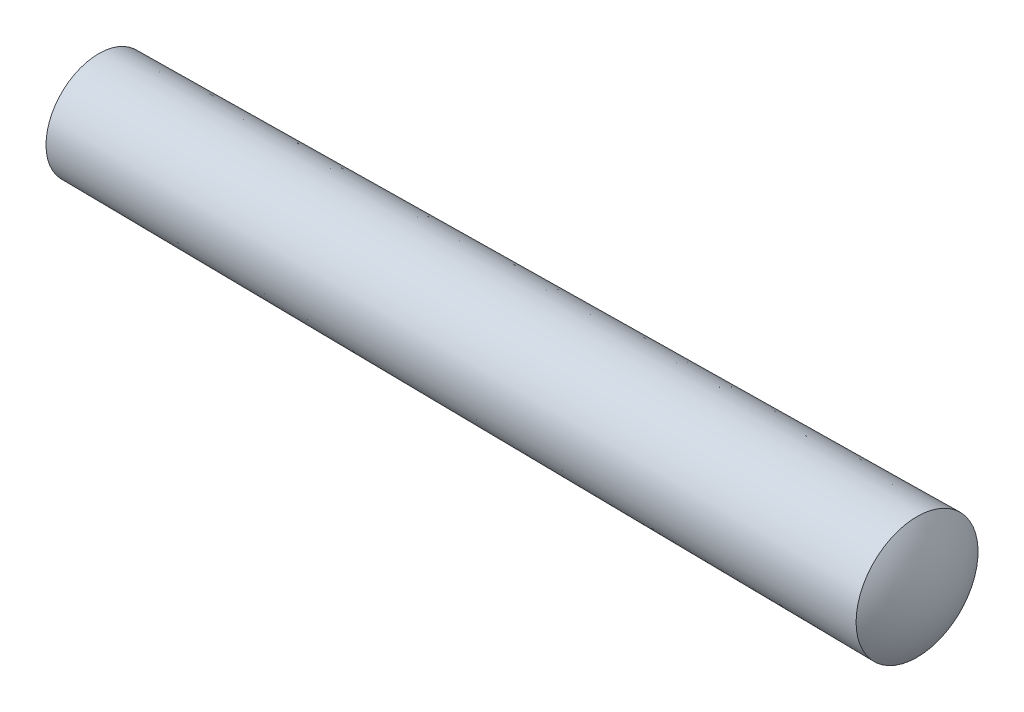
from build123d import *


with BuildPart() as part:
    # BodySke → Body (revolve)
    with BuildSketch(Plane.XY):
        with BuildLine():
            Line((0, 2.5), (38.74, 2.8874))
            ThreePointArc((38.74, 2.8874), (39.422958568, 1.514905806), (39.65797584, 0))
            Line((39.65797584, 0), (-0.669872981, 0))
            ThreePointArc((-0.669872981, 0), (-0.499502113, 1.294095226), (0, 2.5))
        make_face()
    revolve(axis=Axis((-0.669872981, 0, 0), (1, 0, 0)))


solid = part.part
